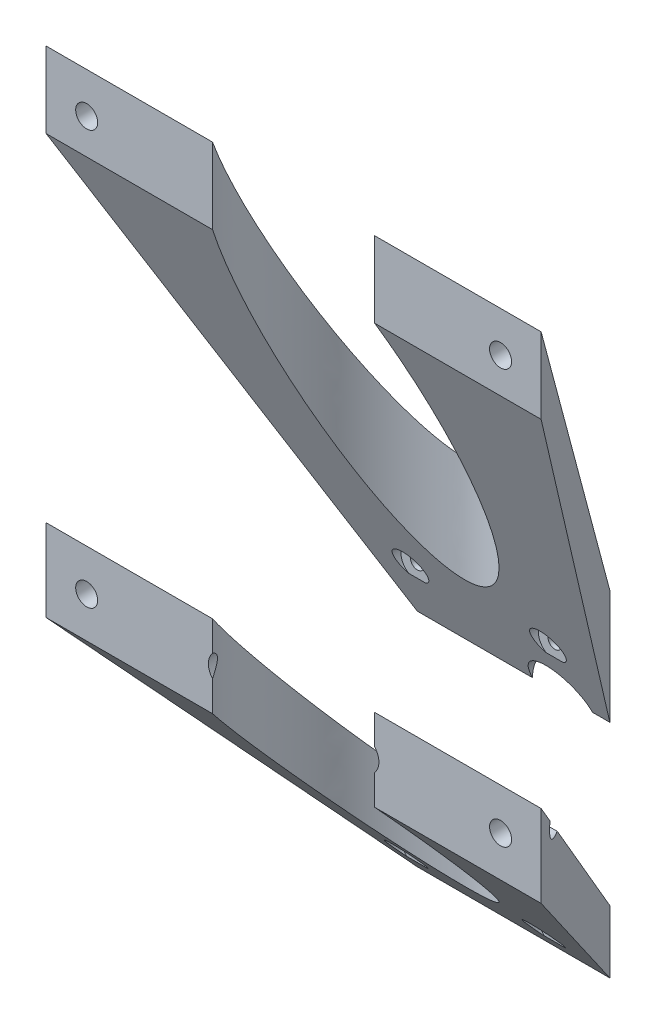
from build123d import *

# Parameters (mm, degrees)
SKETCH_5_R               = 1.25
CUT_EXTRUDE_1_DEPTH      = 122.037184526
CUT_EXTRUDE_START        = -5
SKETCH_6_R               = 3
CUT_EXTRUDE_2_DEPTH      = 117.037184526
SKETCH_7_R               = 2
CUT_EXTRUDE_3_DEPTH      = 122.037184526
CUT_EXTRUDE_START_2      = -3
SKETCH_8_R               = 4
CUT_EXTRUDE_4_DEPTH      = 119.037184526
CUT_EXTRUDE_5_DEPTH      = 122.037184526
CUT_EXTRUDE_5_DEPTH_BACK = 122.037184526
SKETCH_12_RX             = 20.465266771
SKETCH_12_RY             = 17.235422909
SKETCH_13_RX             = 6.190448296
SKETCH_13_RY             = 5.461738086
CUT_EXTRUDE_6_DEPTH      = 10


with BuildPart() as part:
    # Loft 1: read off the stored shape, not the designer's step
    # Loft 1: loft between two sections, ruled curve by curve
    loft_1_from = [
        Edge.make_line((-17.5, 30.5, 0), (17.5, 30.5, 0)),
        Edge.make_line((17.5, 30.5, 0), (17.5, -30.5, 0)),
        Edge.make_line((-17.5, -30.5, 0), (17.5, -30.5, 0)),
        Edge.make_line((-17.5, 30.5, 0), (-17.5, -30.5, 0)),
    ]
    loft_1_to = [
        Edge.make_line((-45, 105, 40), (45, 105, 40)),
        Edge.make_line((45, 105, 40), (45, 15, 40)),
        Edge.make_line((-45, 15, 40), (45, 15, 40)),
        Edge.make_line((-45, 105, 40), (-45, 15, 40)),
    ]
    loft_1 = Solid(Shell([*[Face.make_surface_from_curves(loft_1_from[k], loft_1_to[k]) for k in range(4)], Face(Wire(loft_1_from)), Face(Wire(loft_1_to))]))
    add(loft_1)

    # 草图5 → 切除-拉伸1 (cut, through all)
    with BuildSketch(Plane(origin=(0, 0, 0), x_dir=(-1, 0, 0), z_dir=(0, 0, -1))):
        with Locations((-12.5, 22.5)):
            Circle(SKETCH_5_R)
        with Locations((12.5, 22.5)):
            Circle(SKETCH_5_R)
        with Locations((12.5, -22.5)):
            Circle(SKETCH_5_R)
        with Locations((-12.5, -22.5)):
            Circle(SKETCH_5_R)
    extrude(amount=-CUT_EXTRUDE_1_DEPTH, mode=Mode.SUBTRACT)

    # 草图6 → 切除-拉伸2 (cut, through all)
    with BuildSketch(Plane(origin=(0, 0, 0), x_dir=(-1, 0, 0), z_dir=(0, 0, -1)).offset(CUT_EXTRUDE_START)):
        with Locations((-12.5, 22.5)):
            Circle(SKETCH_6_R)
        with Locations((12.5, 22.5)):
            Circle(SKETCH_6_R)
        with Locations((-12.5, -22.5)):
            Circle(SKETCH_6_R)
        with Locations((12.5, -22.5)):
            Circle(SKETCH_6_R)
    extrude(amount=-CUT_EXTRUDE_2_DEPTH, mode=Mode.SUBTRACT)

    # 草图7 → 切除-拉伸3 (cut, through all)
    with BuildSketch(Plane.XY.offset(40)):
        with Locations((37.625, 22.375)):
            Circle(SKETCH_7_R)
        with Locations((-37.625, 22.375)):
            Circle(SKETCH_7_R)
        with Locations((-37.625, 97.625)):
            Circle(SKETCH_7_R)
        with Locations((37.625, 97.625)):
            Circle(SKETCH_7_R)
    extrude(amount=-CUT_EXTRUDE_3_DEPTH, mode=Mode.SUBTRACT)

    # 草图8 → 切除-拉伸4 (cut, through all)
    with BuildSketch(Plane.XY.offset(40).offset(CUT_EXTRUDE_START_2)):
        with Locations((-37.625, 97.625)):
            Circle(SKETCH_8_R)
        with Locations((37.625, 97.625)):
            Circle(SKETCH_8_R)
        with Locations((37.625, 22.375)):
            Circle(SKETCH_8_R)
        with Locations((-37.625, 22.375)):
            Circle(SKETCH_8_R)
    extrude(amount=-CUT_EXTRUDE_4_DEPTH, mode=Mode.SUBTRACT)

    # 草图11 → Loft 1 2 section 0
    with BuildSketch(Plane.XY.offset(40)):
        with BuildLine():
            Line((-45, 91.216125502), (45, 91.216125502))
            Line((45, 91.216125502), (45, 29.943379718))
            Line((45, 29.943379718), (-45, 29.943379718))
            Line((-45, 29.943379718), (-45, 91.216125502))
        make_face()
    # 草图9 → Loft 1 2 section 1
    with BuildSketch(Plane(origin=(0, 0, 0), x_dir=(-1, 0, 0), z_dir=(0, 0, -1))):
        with BuildLine():
            Line((-17.5, 9.752727906), (17.5, 9.752727906))
            Line((17.5, 9.752727906), (17.5, -19.101844067))
            Line((17.5, -19.101844067), (-17.5, -19.101844067))
            Line((-17.5, -19.101844067), (-17.5, 9.752727906))
        make_face()
    loft(mode=Mode.SUBTRACT)


with BuildPart() as loft_1_2_piece_1:
    # of the separate pieces the step leaves, piece 1, a body of its own (loft_1_2_pieces)
    add(part.part.solids().sort_by_distance((-17.5, 30.5, 0))[0])


with BuildPart() as loft_1_2_piece_2:
    # of the separate pieces the step leaves, piece 2, a body of its own (loft_1_2_pieces)
    add(part.part.solids().sort_by_distance((-17.5, -19.101844067, 0))[0])


with BuildPart() as cut_extrude_5_tool:
    # 草图12 → 切除-拉伸5 (new, two sides: drawn at the far end of the back side and taken through both)
    with BuildSketch(Plane(origin=(0, 0, 0), x_dir=(1, 0, 0), z_dir=(0, 1, 0)).offset(-CUT_EXTRUDE_5_DEPTH_BACK)):
        with Locations(Location((0, -29.400447007), (0, 0, -90))):
            Ellipse(SKETCH_12_RX, SKETCH_12_RY)
    extrude(amount=CUT_EXTRUDE_5_DEPTH + CUT_EXTRUDE_5_DEPTH_BACK)


with BuildPart() as loft_1_2_piece_1_1:
    add(loft_1_2_piece_1.part)

    # 切除-拉伸5: cut by cut_extrude_5_tool
    add(cut_extrude_5_tool.part, mode=Mode.SUBTRACT)

    # 草图13 → 切除-拉伸6 (cut)
    with BuildSketch(Plane(origin=(0, 0, 0), x_dir=(-1, 0, 0), z_dir=(0, 0, -1))):
        with Locations(Location((-8.888677431, 9.752727906), (0, 0, 90))):
            Ellipse(SKETCH_13_RX, SKETCH_13_RY)
    extrude(amount=-CUT_EXTRUDE_6_DEPTH, mode=Mode.SUBTRACT)


with BuildPart() as loft_1_2_piece_2_1:
    add(loft_1_2_piece_2.part)

    # 切除-拉伸5: cut by cut_extrude_5_tool
    add(cut_extrude_5_tool.part, mode=Mode.SUBTRACT)


solid = Compound([loft_1_2_piece_1_1.part, loft_1_2_piece_2_1.part])
